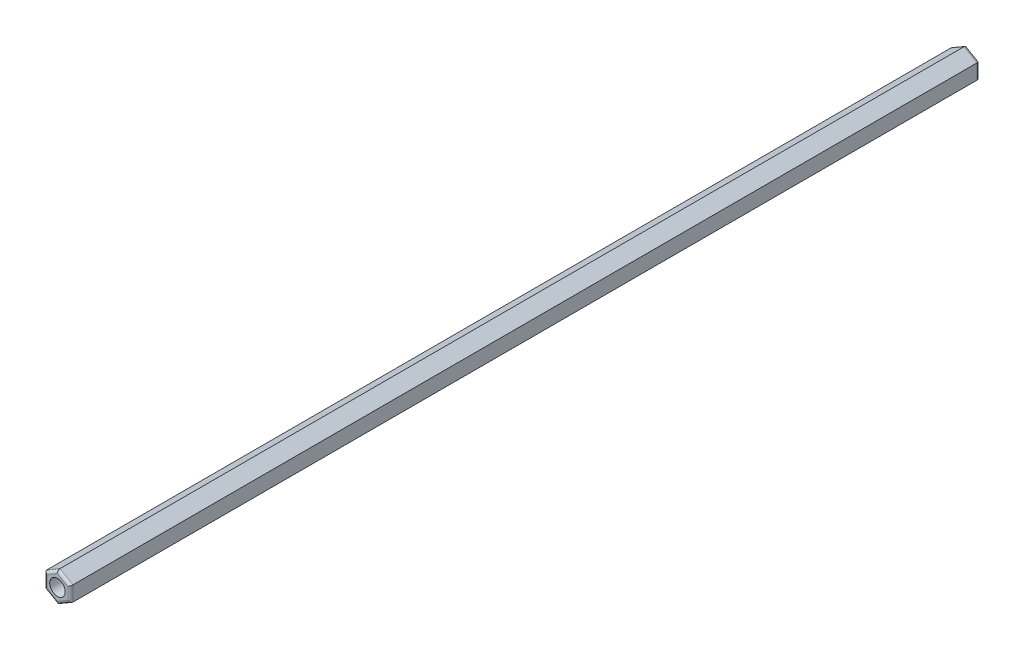
from build123d import *

# Parameters (mm, degrees)
RESSALTO_EXTRUS_O1_DEPTH = 175
FILETE1_R                = 0.5
ESBO_O2_R                = 1.5
CORTE_EXTRUS_O1_DEPTH    = 190.446275038


with BuildPart() as part:
    # Esboço1 → Ressalto-extrusão1 (new body)
    with BuildSketch(Plane(origin=(0, 0, 0), x_dir=(-1, 0, 0), z_dir=(0, 0, -1))):
        Polygon((67.502122675, -1.443375673), (70.002122675, -2.886751346), (72.502122675, -1.443375673), (72.502122675, 1.443375673), (70.002122675, 2.886751346), (67.502122675, 1.443375673), align=None)
    extrude(amount=-RESSALTO_EXTRUS_O1_DEPTH)

    # Filete1
    filete1_edges = [part.edges().sort_by_distance(p)[0] for p in [
        (-71.252122675, 2.165063509, 0),
        (-72.502122675, 0, 0),
        (-68.752122675, 2.165063509, 0),
        (-71.252122675, -2.165063509, 0),
        (-67.502122675, 0, 0),
        (-68.752122675, -2.165063509, 0),
        (-71.252122675, 2.165063509, 175),
        (-72.502122675, 0, 175),
        (-68.752122675, 2.165063509, 175),
        (-71.252122675, -2.165063509, 175),
        (-67.502122675, 0, 175),
        (-68.752122675, -2.165063509, 175),
    ]]
    fillet(filete1_edges, radius=FILETE1_R)

    # Esboço2 → Corte-extrusão1 (cut, through all)
    with BuildSketch(Plane.XY.offset(175)):
        with Locations((-70.002122675, 0)):
            Circle(ESBO_O2_R)
    extrude(amount=-CORTE_EXTRUS_O1_DEPTH, mode=Mode.SUBTRACT)


solid = part.part
